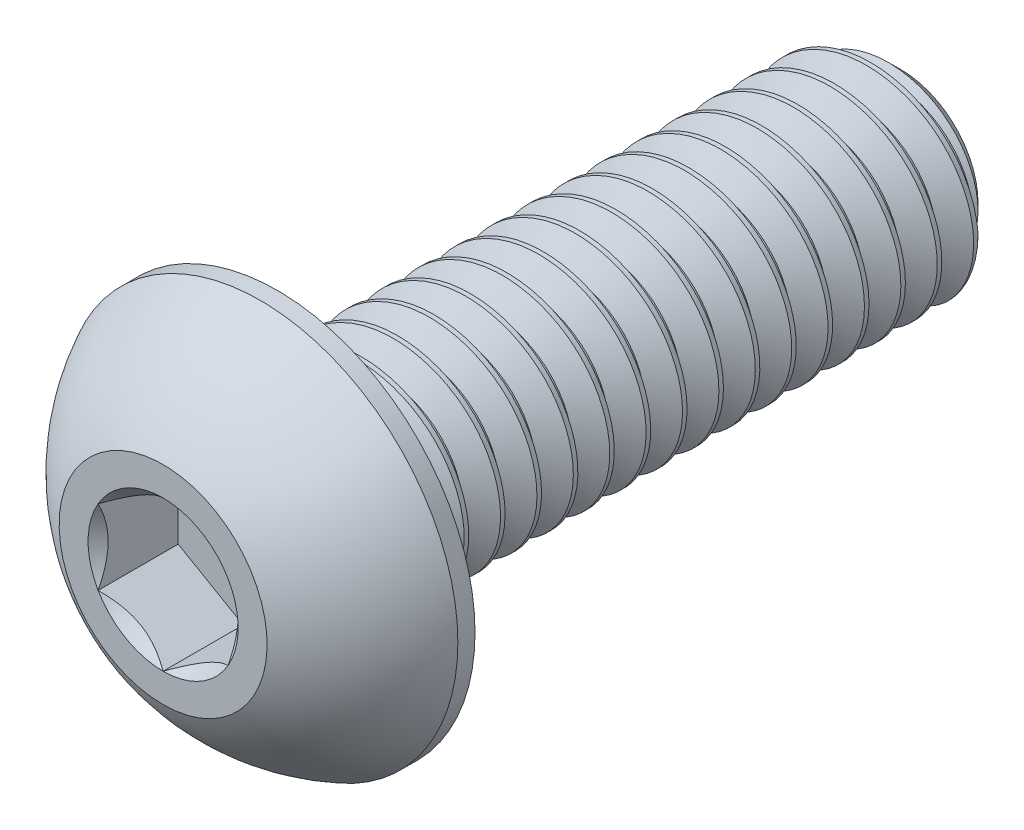
from build123d import *

# Parameters (mm, degrees)
SKETCH1_W          = 12
SKETCH1_H          = 2
CHAMFER1_SIZE      = 0.525
CUT_SWEEP1_PITCH   = 0.7
CUT_EXTRUDE2_DEPTH = 1.54


with BuildPart() as part:
    # Sketch1 → Revolve1 (revolve)
    with BuildSketch(Plane(origin=(0, 0, 0), x_dir=(0, 0, -1), z_dir=(1, 0, 0))):
        with Locations((8.2, 1)):
            Rectangle(SKETCH1_W, SKETCH1_H)
    revolve(axis=Axis((0, 0, -14.2), (0, 0, 1)))

    # Chamfer1
    chamfer1_edges = [part.edges().sort_by_distance(p)[0] for p in [
        (0, -2, -14.2),
    ]]
    chamfer(chamfer1_edges, length=CHAMFER1_SIZE)

    # Cut-Sweep1: the profile of Sketch2 profile screwed along a right-hand helix of 20.285714 turns, 6 arcs to a turn; built about Z, then put on its axis
    cut_sweep1_z = Axis((0, 0, 0), (0, 0, 1))
    cut_sweep1_corners = [(2.0003, 0, 0.000173205), (2.0003, 0, -0.612673205), (1.545336663, 0, -0.35), (1.545336663, 0, -0.2625)]
    with BuildLine(mode=Mode.PRIVATE) as cut_sweep1_profile:
        Line(cut_sweep1_corners[0], cut_sweep1_corners[1])
        Line(cut_sweep1_corners[1], cut_sweep1_corners[2])
        Line(cut_sweep1_corners[2], cut_sweep1_corners[3])
        Line(cut_sweep1_corners[3], cut_sweep1_corners[0])
    cut_sweep1_cap = Face(cut_sweep1_profile.wire())
    cut_sweep1_turn_angles = [0, 30, 60, 90, 120, 150, 180, 210, 240, 270, 300, 330, 360]
    cut_sweep1_turn_weights = [1, 0.8660254037844387, 1, 0.8660254037844387, 1, 0.8660254037844387, 1, 0.8660254037844387, 1, 0.8660254037844387, 1, 0.8660254037844387, 1]
    cut_sweep1_turn_rails = [Edge.make_bspline([Vector(p[0], p[1], 0).rotate(cut_sweep1_z, cut_sweep1_turn_angles[k]) / cut_sweep1_turn_weights[k] + Vector(0, 0, p[2] + CUT_SWEEP1_PITCH * cut_sweep1_turn_angles[k] / 360) for k in range(13)], [0, 0, 0, 1, 1, 2, 2, 3, 3, 4, 4, 5, 5, 6, 6, 6], 2, cut_sweep1_turn_weights) for p in cut_sweep1_corners]
    cut_sweep1_turn_sides = [Face.make_surface_from_curves(cut_sweep1_turn_rails[p[0]], cut_sweep1_turn_rails[p[1]]) for p in [(0, 1), (1, 2), (2, 3), (3, 0)]]
    cut_sweep1_last_angles = [7200, 7230, 7260, 7281.428571429, 7302.857142857]
    cut_sweep1_last_weights = [1, 0.8660254037844387, 1, 0.9308737486441251, 1]
    cut_sweep1_last_rails = [Edge.make_bspline([Vector(p[0], p[1], 0).rotate(cut_sweep1_z, cut_sweep1_last_angles[k]) / cut_sweep1_last_weights[k] + Vector(0, 0, p[2] + CUT_SWEEP1_PITCH * cut_sweep1_last_angles[k] / 360) for k in range(5)], [0, 0, 0, 1, 1, 2, 2, 2], 2, cut_sweep1_last_weights) for p in cut_sweep1_corners]
    cut_sweep1_last_sides = [Face.make_surface_from_curves(cut_sweep1_last_rails[p[0]], cut_sweep1_last_rails[p[1]]) for p in [(0, 1), (1, 2), (2, 3), (3, 0)]]
    cut_sweep1 = Plane(origin=(0, 0, -14.2), x_dir=(0, 1, 0), z_dir=(0, 0, 1)) * Solid(Shell([*[p.moved(Location((0, 0, CUT_SWEEP1_PITCH * i))) for i in range(20) for p in cut_sweep1_turn_sides], *cut_sweep1_last_sides, cut_sweep1_cap, cut_sweep1_cap.rotate(cut_sweep1_z, 7302.857142857).moved(Location((0, 0, CUT_SWEEP1_PITCH * 7302.857142857 / 360)))]))
    add(cut_sweep1, mode=Mode.SUBTRACT)

    # Sketch7 → Revolve2 (revolve)
    with BuildSketch(Plane(origin=(0, 0, 0), x_dir=(0, 0, -1), z_dir=(1, 0, 0)), mode=Mode.PRIVATE) as revolve2_sk:
        with BuildLine():
            Line((1.87, 3.8), (2.2, 3.8))
            Line((2.2, 3.8), (2.2, 0))
            Line((2.2, 0), (0, 0))
            Line((0, 0), (0, 2))
            ThreePointArc((0, 2), (0.793500147, 3.047002626), (1.87, 3.8))
        make_face()
    revolve(revolve2_sk.sketch.rotate(Axis((0, 0, 0), (0, 0, -1)), 189.336081704), axis=Axis((0, 0, 0), (0, 0, -1)))

    # Sketch5 → Cut-Extrude2 (cut)
    with BuildSketch(Plane.XY):
        Polygon((1.25, -0.721687836), (1.25, 0.721687836), (0, 1.443375673), (-1.25, 0.721687836), (-1.25, -0.721687836), (0, -1.443375673), align=None)
    extrude(amount=-CUT_EXTRUDE2_DEPTH, mode=Mode.SUBTRACT)

    # Cut-Extrude3 cone 1 section (through the dimple's axis) → Cut-Extrude3 (revolve, cut)
    with BuildSketch(Plane(origin=(0, 0, 0), x_dir=(0, -1, 0), z_dir=(1, 0, 0))):
        Polygon((0, 0), (1.443375673, 0), (0, 1.443375673), align=None)
    revolve(axis=Axis((0, 0, 0), (0, 0, -1)), mode=Mode.SUBTRACT)


solid = part.part
